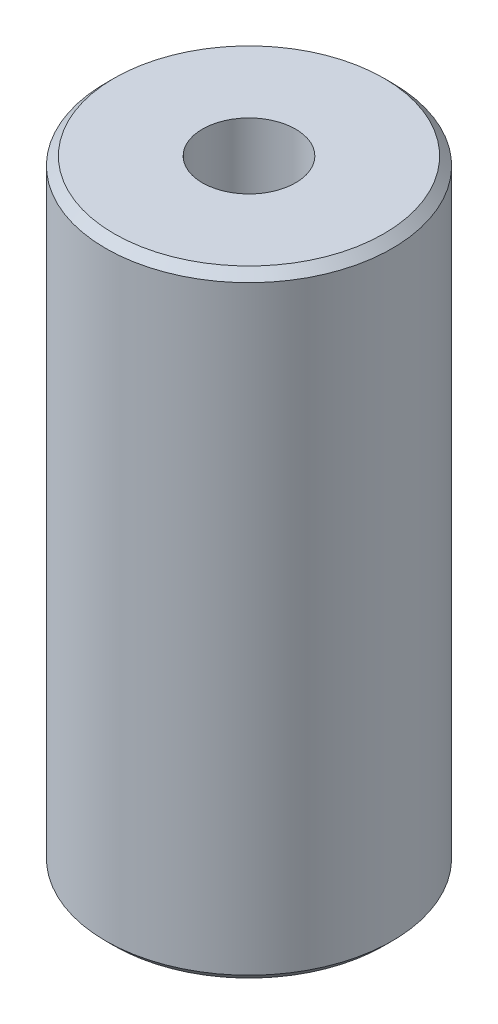
from build123d import *

# Parameters (mm, degrees)
SKETCH1_R           = 60
BOSS_EXTRUDE1_DEPTH = 258.258872666
SKETCH2_R           = 19.512522942
CUT_EXTRUDE1_DEPTH  = 272.841213415
CHAMFER1_SIZE       = 3.543139442


with BuildPart() as part:
    # Sketch1 → Boss-Extrude1 (new body)
    with BuildSketch(Plane(origin=(0, 0, 0), x_dir=(1, 0, 0), z_dir=(0, 1, 0))):
        Circle(SKETCH1_R)
    extrude(amount=BOSS_EXTRUDE1_DEPTH)

    # Sketch2 → Cut-Extrude1 (cut, through all)
    with BuildSketch(Plane(origin=(0, 0, 0), x_dir=(1, 0, 0), z_dir=(0, 1, 0))):
        Circle(SKETCH2_R)
    extrude(amount=CUT_EXTRUDE1_DEPTH, mode=Mode.SUBTRACT)

    # Chamfer1
    chamfer1_edges = [part.edges().sort_by_distance(p)[0] for p in [
        (-60, 258.258872666, 0),
        (-60, 0, 0),
    ]]
    chamfer(chamfer1_edges, length=CHAMFER1_SIZE)


solid = part.part
